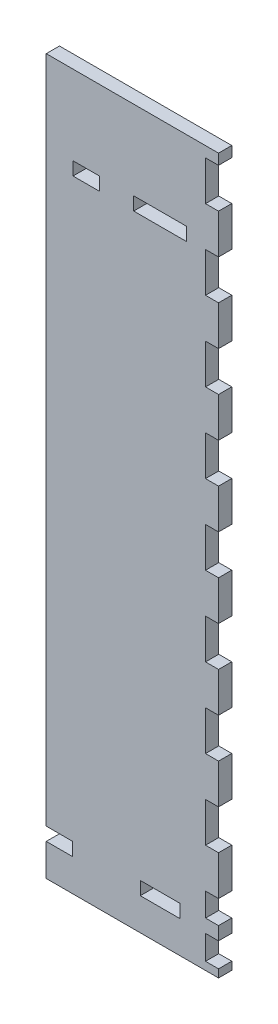
from build123d import *

# Parameters (mm, degrees)
ESQUISSE1_W             = 65.121094869
ESQUISSE1_H             = 270
BOSS_EXTRU_1_DEPTH      = 5
ESQUISSE2_W             = 10
ESQUISSE2_H             = 5
ESQUISSE2_W_2           = 15
ESQUISSE2_W_3           = 4.92
ESQUISSE2_H_2           = 9.15
ESQUISSE2_H_3           = 8.85
ESQUISSE2_H_4           = 15
ESQUISSE2_W_4           = 20
ENL_V_MAT_EXTRU_1_DEPTH = 5


with BuildPart() as part:
    # Esquisse1 → Boss.-Extru.1 (new body)
    with BuildSketch(Plane.XY):
        with Locations((32.560547435, 135)):
            Rectangle(ESQUISSE1_W, ESQUISSE1_H)
    extrude(amount=-BOSS_EXTRU_1_DEPTH)

    # Esquisse2 → Enlèv. mat.-Extru.1 (cut)
    with BuildSketch(Plane.XY):
        with Locations((5, 14.65)):
            Rectangle(ESQUISSE2_W, ESQUISSE2_H)
        with Locations((43.049292824, 14.65)):
            Rectangle(ESQUISSE2_W_2, ESQUISSE2_H)
        with Locations((62.661094869, 7.575)):
            Rectangle(ESQUISSE2_W_3, ESQUISSE2_H_2)
        with Locations((62.661094869, 21.575)):
            Rectangle(ESQUISSE2_W_3, ESQUISSE2_H_3)
        with Locations((62.661094869, 258.5)):
            Rectangle(ESQUISSE2_W_3, ESQUISSE2_H_4)
        with Locations((62.661094869, 228.5)):
            Rectangle(ESQUISSE2_W_3, ESQUISSE2_H_4)
        with Locations((62.661094869, 198.5)):
            Rectangle(ESQUISSE2_W_3, ESQUISSE2_H_4)
        with Locations((62.661094869, 168.5)):
            Rectangle(ESQUISSE2_W_3, ESQUISSE2_H_4)
        with Locations((62.661094869, 138.5)):
            Rectangle(ESQUISSE2_W_3, ESQUISSE2_H_4)
        with Locations((62.661094869, 108.5)):
            Rectangle(ESQUISSE2_W_3, ESQUISSE2_H_4)
        with Locations((62.661094869, 78.5)):
            Rectangle(ESQUISSE2_W_3, ESQUISSE2_H_4)
        with Locations((62.661094869, 48.5)):
            Rectangle(ESQUISSE2_W_3, ESQUISSE2_H_4)
        with Locations((15.121094869, 237.5)):
            Rectangle(ESQUISSE2_W, ESQUISSE2_H)
        with Locations((43.049292824, 237.5)):
            Rectangle(ESQUISSE2_W_4, ESQUISSE2_H)
    extrude(amount=-ENL_V_MAT_EXTRU_1_DEPTH, mode=Mode.SUBTRACT)


solid = part.part
